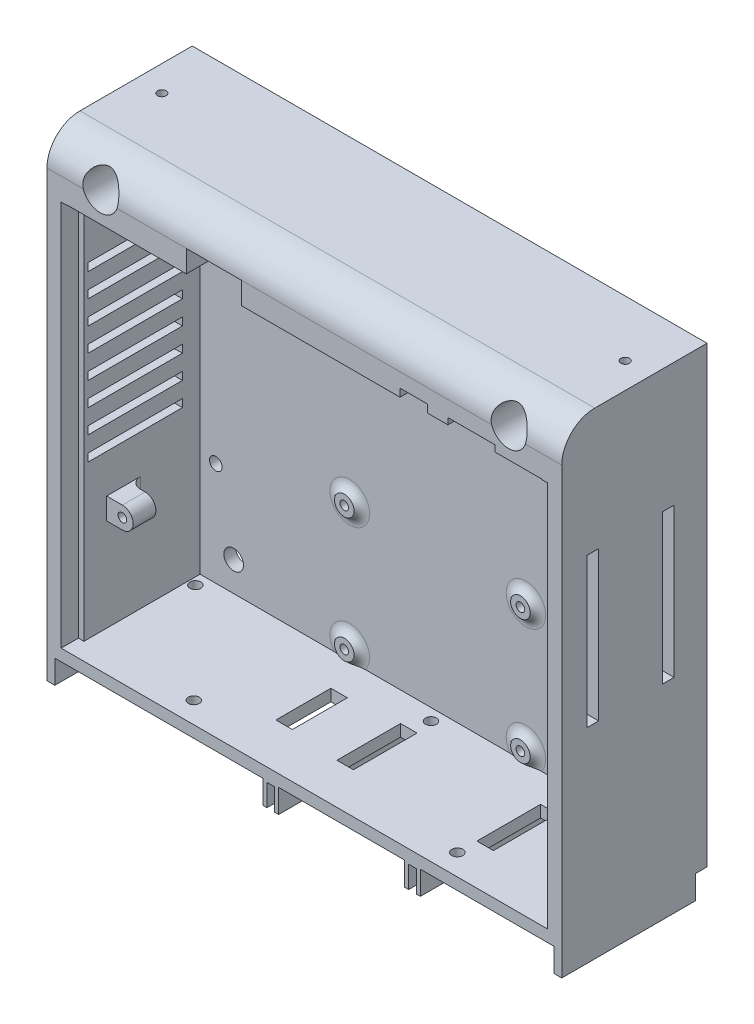
from build123d import *

# Parameters (mm, degrees)
CROQUIS1_W               = 131.1
CROQUIS1_H               = 109.5
SALIENTE_EXTRUIR2_DEPTH  = 39
CORTAR_EXTRUIR1_DEPTH    = 36
SALIENTE_EXTRUIR6_START  = 18
CROQUIS3_R               = 2.75
CROQUIS3_R_2             = 1.1
SALIENTE_EXTRUIR6_DEPTH  = 5.8
REDONDEO1_R              = 2.8
CROQUIS4_W               = 131.1
CROQUIS4_H               = 6
SALIENTE_EXTRUIR7_DEPTH  = 39
CORTAR_EXTRUIR3_REACH    = 181.021
CROQUIS5_W               = 24
CROQUIS5_H               = 2
CORTAR_EXTRUIR4_REACH    = 181.021
CROQUIS6_W               = 3
CROQUIS6_H               = 38
CORTAR_EXTRUIR5_START    = -10
CROQUIS7_R               = 1.6
CROQUIS7_R_2             = 1.1
CORTAR_EXTRUIR5_DEPTH    = 10
CROQUIS9_W               = 131.1
CROQUIS9_H               = 115.5
CORTAR_EXTRUIR6_DEPTH    = 2
CROQUIS10_W              = 1.4
CROQUIS10_H              = 98.387821421
CORTAR_EXTRUIR7_DEPTH    = 4.4
CORTAR_EXTRUIR9_REACH    = 180.596
CROQUIS13_R              = 2.5
CROQUIS12_R              = 4.5
CORTAR_EXTRUIR10_DEPTH   = 33
REDONDEO3_R              = 8.4
CORTAR_EXTRUIR11_REACH   = 180.596
CROQUIS15_R              = 1.1
CORTAR_EXTRUIR13_REACH   = 179.998
CROQUIS16_R              = 1.1
SALIENTE_EXTRUIR8_START  = 1.4
CROQUIS17_R              = 2.5
CROQUIS17_R_2            = 1.1
SALIENTE_EXTRUIR8_DEPTH  = 1.4
REDONDEO4_R              = 3
CORTAR_EXTRUIR14_REACH   = 180.596
CROQUIS18_W              = 4.2
CROQUIS18_H              = 16.2
CROQUIS18_H_2            = 14
CROQUIS19_W              = 2
CROQUIS19_H              = 6
SALIENTE_EXTRUIR10_DEPTH = 34
CORTAR_EXTRUIR15_REACH   = 180.596
CROQUIS22_R              = 1.4
CORTAR_EXTRUIR19_DEPTH   = 3


with BuildPart() as part:
    # Croquis1 → Saliente-Extruir2 (new body)
    with BuildSketch(Plane.XY):
        with Locations((65.55, 54.75)):
            Rectangle(CROQUIS1_W, CROQUIS1_H)
    extrude(amount=SALIENTE_EXTRUIR2_DEPTH)

    # Croquis2 → Cortar-Extruir1 (cut)
    with BuildSketch(Plane.XY.offset(39)):
        Polygon((5, 101.5), (35.5, 101.5), (35.5, 107.1), (49.5, 107.1), (49.5, 101.5), (89.9, 101.5), (89.9, 103.5), (96.9, 103.5), (96.9, 101.5), (102.1, 101.5), (102.1, 103.1), (114.1, 103.1), (114.1, 101.5), (126.1, 101.5), (126.1, 3), (5, 3), align=None)
    extrude(amount=-CORTAR_EXTRUIR1_DEPTH, mode=Mode.SUBTRACT)

    # Croquis3 → Saliente-Extruir6 (add)
    # profile 1 of 8: a face of its own
    with BuildSketch(Plane.XY.offset(3).offset(SALIENTE_EXTRUIR6_START)):
        with Locations((9, 97.5)):
            Circle(CROQUIS3_R)
        with Locations((9, 97.5)):
            Circle(CROQUIS3_R_2, mode=Mode.SUBTRACT)
    # profile 2 of 8: a face of its own
    with BuildSketch(Plane.XY.offset(3).offset(SALIENTE_EXTRUIR6_START)):
        with BuildLine():
            ThreePointArc((9, 94.75), (6.25, 97.5), (9, 100.25))
            Line((9, 100.25), (5, 100.25))
            Line((5, 100.25), (5, 94.75))
            Line((5, 94.75), (9, 94.75))
        make_face()
    # profile 3 of 8: a face of its own
    with BuildSketch(Plane.XY.offset(3).offset(SALIENTE_EXTRUIR6_START)):
        with Locations((122.1, 97.5)):
            Circle(CROQUIS3_R)
        with Locations((122.1, 97.5)):
            Circle(CROQUIS3_R_2, mode=Mode.SUBTRACT)
    # profile 4 of 8: a face of its own
    with BuildSketch(Plane.XY.offset(3).offset(SALIENTE_EXTRUIR6_START)):
        with BuildLine():
            Line((122.1, 94.75), (126.1, 94.75))
            Line((126.1, 94.75), (126.1, 100.25))
            Line((126.1, 100.25), (122.1, 100.25))
            ThreePointArc((122.1, 100.25), (124.044543648, 99.444543648), (124.85, 97.5))
            ThreePointArc((124.85, 97.5), (124.044543648, 95.555456352), (122.1, 94.75))
        make_face()
    # profile 5 of 8: a face of its own
    with BuildSketch(Plane.XY.offset(3).offset(SALIENTE_EXTRUIR6_START)):
        with Locations((122.1, 29.4)):
            Circle(CROQUIS3_R)
        with Locations((122.1, 29.4)):
            Circle(CROQUIS3_R_2, mode=Mode.SUBTRACT)
    # profile 6 of 8: a face of its own
    with BuildSketch(Plane.XY.offset(3).offset(SALIENTE_EXTRUIR6_START)):
        with BuildLine():
            ThreePointArc((124.85, 29.4), (124.044543648, 27.455456352), (122.1, 26.65))
            Line((122.1, 26.65), (126.1, 26.65))
            Line((126.1, 26.65), (126.1, 32.15))
            Line((126.1, 32.15), (122.1, 32.15))
            ThreePointArc((122.1, 32.15), (124.044543648, 31.344543648), (124.85, 29.4))
        make_face()
    # profile 7 of 8: a face of its own
    with BuildSketch(Plane.XY.offset(3).offset(SALIENTE_EXTRUIR6_START)):
        with Locations((9, 29.4)):
            Circle(CROQUIS3_R)
        with Locations((9, 29.4)):
            Circle(CROQUIS3_R_2, mode=Mode.SUBTRACT)
    # profile 8 of 8: a face of its own
    with BuildSketch(Plane.XY.offset(3).offset(SALIENTE_EXTRUIR6_START)):
        with BuildLine():
            Line((9, 32.15), (5, 32.15))
            Line((5, 32.15), (5, 26.65))
            Line((5, 26.65), (9, 26.65))
            ThreePointArc((9, 26.65), (6.25, 29.4), (9, 32.15))
        make_face()
    extrude(amount=SALIENTE_EXTRUIR6_DEPTH)

    # Redondeo1
    redondeo1_edges = [part.edges().sort_by_distance(p)[0] for p in [
        (5, 97.5, 21),
        (126.1, 97.5, 21),
        (126.1, 29.4, 21),
        (5, 29.4, 21),
    ]]
    fillet(redondeo1_edges, radius=REDONDEO1_R)

    # Croquis4 → Saliente-Extruir7 (add)
    with BuildSketch(Plane.XY.offset(39)):
        with Locations((65.55, 112.5)):
            Rectangle(CROQUIS4_W, CROQUIS4_H)
    extrude(amount=-SALIENTE_EXTRUIR7_DEPTH)

    # Croquis5 → Cortar-Extruir3 (cut, up to next)
    with BuildSketch(Plane.ZY, mode=Mode.PRIVATE) as cortar_extruir3_sk1:
        with Locations((19.5, 49)):
            Rectangle(CROQUIS5_W, CROQUIS5_H)
    cortar_extruir3_tool1 = extrude(cortar_extruir3_sk1.sketch, amount=-CORTAR_EXTRUIR3_REACH, mode=Mode.PRIVATE) & part.part
    # Croquis5 → Cortar-Extruir3 (cut, up to next)
    with BuildSketch(Plane.ZY, mode=Mode.PRIVATE) as cortar_extruir3_sk2:
        with Locations((19.5, 43)):
            Rectangle(CROQUIS5_W, CROQUIS5_H)
    cortar_extruir3_tool2 = extrude(cortar_extruir3_sk2.sketch, amount=-CORTAR_EXTRUIR3_REACH, mode=Mode.PRIVATE) & part.part
    # Croquis5 → Cortar-Extruir3 (cut, up to next)
    with BuildSketch(Plane.ZY, mode=Mode.PRIVATE) as cortar_extruir3_sk3:
        with Locations((19.5, 55)):
            Rectangle(CROQUIS5_W, CROQUIS5_H)
    cortar_extruir3_tool3 = extrude(cortar_extruir3_sk3.sketch, amount=-CORTAR_EXTRUIR3_REACH, mode=Mode.PRIVATE) & part.part
    # Croquis5 → Cortar-Extruir3 (cut, up to next)
    with BuildSketch(Plane.ZY, mode=Mode.PRIVATE) as cortar_extruir3_sk4:
        with Locations((19.5, 61)):
            Rectangle(CROQUIS5_W, CROQUIS5_H)
    cortar_extruir3_tool4 = extrude(cortar_extruir3_sk4.sketch, amount=-CORTAR_EXTRUIR3_REACH, mode=Mode.PRIVATE) & part.part
    # Croquis5 → Cortar-Extruir3 (cut, up to next)
    with BuildSketch(Plane.ZY, mode=Mode.PRIVATE) as cortar_extruir3_sk5:
        with Locations((19.5, 67)):
            Rectangle(CROQUIS5_W, CROQUIS5_H)
    cortar_extruir3_tool5 = extrude(cortar_extruir3_sk5.sketch, amount=-CORTAR_EXTRUIR3_REACH, mode=Mode.PRIVATE) & part.part
    # Croquis5 → Cortar-Extruir3 (cut, up to next)
    with BuildSketch(Plane.ZY, mode=Mode.PRIVATE) as cortar_extruir3_sk6:
        with Locations((19.5, 73)):
            Rectangle(CROQUIS5_W, CROQUIS5_H)
    cortar_extruir3_tool6 = extrude(cortar_extruir3_sk6.sketch, amount=-CORTAR_EXTRUIR3_REACH, mode=Mode.PRIVATE) & part.part
    # Croquis5 → Cortar-Extruir3 (cut, up to next)
    with BuildSketch(Plane.ZY, mode=Mode.PRIVATE) as cortar_extruir3_sk7:
        with Locations((19.5, 79)):
            Rectangle(CROQUIS5_W, CROQUIS5_H)
    cortar_extruir3_tool7 = extrude(cortar_extruir3_sk7.sketch, amount=-CORTAR_EXTRUIR3_REACH, mode=Mode.PRIVATE) & part.part
    # Croquis5 → Cortar-Extruir3 (cut, up to next)
    with BuildSketch(Plane.ZY, mode=Mode.PRIVATE) as cortar_extruir3_sk8:
        with Locations((19.5, 85)):
            Rectangle(CROQUIS5_W, CROQUIS5_H)
    cortar_extruir3_tool8 = extrude(cortar_extruir3_sk8.sketch, amount=-CORTAR_EXTRUIR3_REACH, mode=Mode.PRIVATE) & part.part
    add(cortar_extruir3_tool1.solids().sort_by_distance((0, 49, 19.5))[0], mode=Mode.SUBTRACT)
    add(cortar_extruir3_tool2.solids().sort_by_distance((0, 43, 19.5))[0], mode=Mode.SUBTRACT)
    add(cortar_extruir3_tool3.solids().sort_by_distance((0, 55, 19.5))[0], mode=Mode.SUBTRACT)
    add(cortar_extruir3_tool4.solids().sort_by_distance((0, 61, 19.5))[0], mode=Mode.SUBTRACT)
    add(cortar_extruir3_tool5.solids().sort_by_distance((0, 67, 19.5))[0], mode=Mode.SUBTRACT)
    add(cortar_extruir3_tool6.solids().sort_by_distance((0, 73, 19.5))[0], mode=Mode.SUBTRACT)
    add(cortar_extruir3_tool7.solids().sort_by_distance((0, 79, 19.5))[0], mode=Mode.SUBTRACT)
    add(cortar_extruir3_tool8.solids().sort_by_distance((0, 85, 19.5))[0], mode=Mode.SUBTRACT)

    # Croquis6 → Cortar-Extruir4 (cut, up to next)
    with BuildSketch(Plane(origin=(131.1, 0, 0), x_dir=(0, 0, -1), z_dir=(1, 0, 0)), mode=Mode.PRIVATE) as cortar_extruir4_sk1:
        with Locations((-29.1, 65)):
            Rectangle(CROQUIS6_W, CROQUIS6_H)
    cortar_extruir4_tool1 = extrude(cortar_extruir4_sk1.sketch, amount=-CORTAR_EXTRUIR4_REACH, mode=Mode.PRIVATE) & part.part
    # Croquis6 → Cortar-Extruir4 (cut, up to next)
    with BuildSketch(Plane(origin=(131.1, 0, 0), x_dir=(0, 0, -1), z_dir=(1, 0, 0)), mode=Mode.PRIVATE) as cortar_extruir4_sk2:
        with Locations((-9.9, 65)):
            Rectangle(CROQUIS6_W, CROQUIS6_H)
    cortar_extruir4_tool2 = extrude(cortar_extruir4_sk2.sketch, amount=-CORTAR_EXTRUIR4_REACH, mode=Mode.PRIVATE) & part.part
    add(cortar_extruir4_tool1.solids().sort_by_distance((131.1, 65, 29.1))[0], mode=Mode.SUBTRACT)
    add(cortar_extruir4_tool2.solids().sort_by_distance((131.1, 65, 9.9))[0], mode=Mode.SUBTRACT)

    # Croquis7 → Cortar-Extruir5 (cut)
    # profile 1 of 8: a face of its own
    with BuildSketch(Plane.XY.offset(3).offset(CORTAR_EXTRUIR5_START)):
        with Locations((9, 97.5)):
            Circle(CROQUIS7_R)
        with Locations((9, 97.5)):
            Circle(CROQUIS7_R_2, mode=Mode.SUBTRACT)
    # profile 2 of 8: a face of its own
    with BuildSketch(Plane.XY.offset(3).offset(CORTAR_EXTRUIR5_START)):
        with Locations((9, 97.5)):
            Circle(CROQUIS7_R_2)
    # profile 3 of 8: a face of its own
    with BuildSketch(Plane.XY.offset(3).offset(CORTAR_EXTRUIR5_START)):
        with Locations((122.1, 97.5)):
            Circle(CROQUIS7_R)
        with Locations((122.1, 97.5)):
            Circle(CROQUIS7_R_2, mode=Mode.SUBTRACT)
    # profile 4 of 8: a face of its own
    with BuildSketch(Plane.XY.offset(3).offset(CORTAR_EXTRUIR5_START)):
        with Locations((122.1, 97.5)):
            Circle(CROQUIS7_R_2)
    # profile 5 of 8: a face of its own
    with BuildSketch(Plane.XY.offset(3).offset(CORTAR_EXTRUIR5_START)):
        with Locations((122.1, 29.4)):
            Circle(CROQUIS7_R)
        with Locations((122.1, 29.4)):
            Circle(CROQUIS7_R_2, mode=Mode.SUBTRACT)
    # profile 6 of 8: a face of its own
    with BuildSketch(Plane.XY.offset(3).offset(CORTAR_EXTRUIR5_START)):
        with Locations((122.1, 29.4)):
            Circle(CROQUIS7_R_2)
    # profile 7 of 8: a face of its own
    with BuildSketch(Plane.XY.offset(3).offset(CORTAR_EXTRUIR5_START)):
        with Locations((9, 29.4)):
            Circle(CROQUIS7_R)
        with Locations((9, 29.4)):
            Circle(CROQUIS7_R_2, mode=Mode.SUBTRACT)
    # profile 8 of 8: a face of its own
    with BuildSketch(Plane.XY.offset(3).offset(CORTAR_EXTRUIR5_START)):
        with Locations((9, 29.4)):
            Circle(CROQUIS7_R_2)
    extrude(amount=CORTAR_EXTRUIR5_DEPTH, mode=Mode.SUBTRACT)

    # Croquis9 → Cortar-Extruir6 (cut)
    with BuildSketch(Plane.XY.offset(39)):
        with Locations((65.55, 57.75)):
            Rectangle(CROQUIS9_W, CROQUIS9_H)
    extrude(amount=-CORTAR_EXTRUIR6_DEPTH, mode=Mode.SUBTRACT)

    # Croquis10 → Cortar-Extruir7 (cut)
    with BuildSketch(Plane.XY.offset(37)):
        with Locations((4.3, 52.193910711)):
            Rectangle(CROQUIS10_W, CROQUIS10_H)
        with Locations((126.8, 52.193910711)):
            Rectangle(CROQUIS10_W, CROQUIS10_H)
    extrude(amount=-CORTAR_EXTRUIR7_DEPTH, mode=Mode.SUBTRACT)

    # Croquis13 → Cortar-Extruir9 (cut, up to next)
    with BuildSketch(Plane.XY.offset(37), mode=Mode.PRIVATE) as cortar_extruir9_sk1:
        with Locations((13.55, 108.5)):
            Circle(CROQUIS13_R)
    cortar_extruir9_tool1 = extrude(cortar_extruir9_sk1.sketch, amount=-CORTAR_EXTRUIR9_REACH, mode=Mode.PRIVATE) & part.part
    # Croquis13 → Cortar-Extruir9 (cut, up to next)
    with BuildSketch(Plane.XY.offset(37), mode=Mode.PRIVATE) as cortar_extruir9_sk2:
        with Locations((117.55, 108.5)):
            Circle(CROQUIS13_R)
    cortar_extruir9_tool2 = extrude(cortar_extruir9_sk2.sketch, amount=-CORTAR_EXTRUIR9_REACH, mode=Mode.PRIVATE) & part.part
    # Croquis13 → Cortar-Extruir9 (cut, up to next)
    with BuildSketch(Plane.XY.offset(37), mode=Mode.PRIVATE) as cortar_extruir9_sk3:
        with Locations(Location((13.55, 10.5, 0), (0, 0, 180))):
            Circle(CROQUIS13_R)
    cortar_extruir9_tool3 = extrude(cortar_extruir9_sk3.sketch, amount=-CORTAR_EXTRUIR9_REACH, mode=Mode.PRIVATE) & part.part
    # Croquis13 → Cortar-Extruir9 (cut, up to next)
    with BuildSketch(Plane.XY.offset(37), mode=Mode.PRIVATE) as cortar_extruir9_sk4:
        with Locations(Location((117.55, 10.5, 0), (0, 0, 180))):
            Circle(CROQUIS13_R)
    cortar_extruir9_tool4 = extrude(cortar_extruir9_sk4.sketch, amount=-CORTAR_EXTRUIR9_REACH, mode=Mode.PRIVATE) & part.part
    add(cortar_extruir9_tool1.solids().sort_by_distance((13.55, 108.5, 37))[0], mode=Mode.SUBTRACT)
    add(cortar_extruir9_tool2.solids().sort_by_distance((117.55, 108.5, 37))[0], mode=Mode.SUBTRACT)
    add(cortar_extruir9_tool3.solids().sort_by_distance((13.55, 10.5, 37))[0], mode=Mode.SUBTRACT)
    add(cortar_extruir9_tool4.solids().sort_by_distance((117.55, 10.5, 37))[0], mode=Mode.SUBTRACT)

    # Croquis12 → Cortar-Extruir10 (cut)
    with BuildSketch(Plane.XY.offset(37)):
        with Locations((13.55, 108.5)):
            Circle(CROQUIS12_R)
        with Locations(Location((117.55, 108.5, 0), (0, 0, 180))):
            Circle(CROQUIS12_R)
        with Locations((13.55, 10.5)):
            Circle(CROQUIS12_R)
        with Locations((117.55, 10.5)):
            Circle(CROQUIS12_R)
    extrude(amount=-CORTAR_EXTRUIR10_DEPTH, mode=Mode.SUBTRACT)

    # Redondeo3
    # the kernel refuses this fillet: 8.4 mm, written as the material it takes off along each edge
    with BuildSketch(Plane(origin=(152.1, 115.5, 37), x_dir=(0, -1, 0), z_dir=(-1, 0, 0))) as redondeo3_piece_1:
        with BuildLine():
            CenterArc((REDONDEO3_R, -REDONDEO3_R), REDONDEO3_R, 90, 90)
            Line((0, -REDONDEO3_R), (0, 0))
            Line((0, 0), (REDONDEO3_R, 0))
        make_face()
    extrude(amount=173.1, mode=Mode.SUBTRACT)

    # Croquis15 → Cortar-Extruir11 (cut, up to next)
    with BuildSketch(Plane(origin=(0, 115.5, 0), x_dir=(1, 0, 0), z_dir=(0, 1, 0)), mode=Mode.PRIVATE) as cortar_extruir11_sk1:
        with Locations(Location((6.55, -14.3, 0), (0, 0, 180))):
            Circle(CROQUIS15_R)
    cortar_extruir11_tool1 = extrude(cortar_extruir11_sk1.sketch, amount=-CORTAR_EXTRUIR11_REACH, mode=Mode.PRIVATE) & part.part
    # Croquis15 → Cortar-Extruir11 (cut, up to next)
    with BuildSketch(Plane(origin=(0, 115.5, 0), x_dir=(1, 0, 0), z_dir=(0, 1, 0)), mode=Mode.PRIVATE) as cortar_extruir11_sk2:
        with Locations(Location((124.55, -14.3, 0), (0, 0, 90))):
            Circle(CROQUIS15_R)
    cortar_extruir11_tool2 = extrude(cortar_extruir11_sk2.sketch, amount=-CORTAR_EXTRUIR11_REACH, mode=Mode.PRIVATE) & part.part
    add(cortar_extruir11_tool1.solids().sort_by_distance((6.55, 115.5, 14.3))[0], mode=Mode.SUBTRACT)
    add(cortar_extruir11_tool2.solids().sort_by_distance((124.55, 115.5, 14.3))[0], mode=Mode.SUBTRACT)

    # Croquis16 → Cortar-Extruir13 (cut, up to next)
    with BuildSketch(Plane.XY.offset(3), mode=Mode.PRIVATE) as cortar_extruir13_sk1:
        with Locations((43.12, 37.93)):
            Circle(CROQUIS16_R)
    cortar_extruir13_tool1 = extrude(cortar_extruir13_sk1.sketch, amount=-CORTAR_EXTRUIR13_REACH, mode=Mode.PRIVATE) & part.part
    # Croquis16 → Cortar-Extruir13 (cut, up to next)
    with BuildSketch(Plane.XY.offset(3), mode=Mode.PRIVATE) as cortar_extruir13_sk2:
        with Locations((87.98, 37.93)):
            Circle(CROQUIS16_R)
    cortar_extruir13_tool2 = extrude(cortar_extruir13_sk2.sketch, amount=-CORTAR_EXTRUIR13_REACH, mode=Mode.PRIVATE) & part.part
    # Croquis16 → Cortar-Extruir13 (cut, up to next)
    with BuildSketch(Plane.XY.offset(3), mode=Mode.PRIVATE) as cortar_extruir13_sk3:
        with Locations((87.98, 6.17)):
            Circle(CROQUIS16_R)
    cortar_extruir13_tool3 = extrude(cortar_extruir13_sk3.sketch, amount=-CORTAR_EXTRUIR13_REACH, mode=Mode.PRIVATE) & part.part
    # Croquis16 → Cortar-Extruir13 (cut, up to next)
    with BuildSketch(Plane.XY.offset(3), mode=Mode.PRIVATE) as cortar_extruir13_sk4:
        with Locations((43.12, 6.17)):
            Circle(CROQUIS16_R)
    cortar_extruir13_tool4 = extrude(cortar_extruir13_sk4.sketch, amount=-CORTAR_EXTRUIR13_REACH, mode=Mode.PRIVATE) & part.part
    add(cortar_extruir13_tool1.solids().sort_by_distance((43.12, 37.93, 3))[0], mode=Mode.SUBTRACT)
    add(cortar_extruir13_tool2.solids().sort_by_distance((87.98, 37.93, 3))[0], mode=Mode.SUBTRACT)
    add(cortar_extruir13_tool3.solids().sort_by_distance((87.98, 6.17, 3))[0], mode=Mode.SUBTRACT)
    add(cortar_extruir13_tool4.solids().sort_by_distance((43.12, 6.17, 3))[0], mode=Mode.SUBTRACT)

    # Croquis17 → Saliente-Extruir8 (add)
    # profile 1 of 4: a face of its own
    with BuildSketch(Plane.XY.offset(3).offset(SALIENTE_EXTRUIR8_START)):
        with Locations(Location((43.12, 37.93, 0), (0, 0, 180))):
            Circle(CROQUIS17_R)
        with Locations((43.12, 37.93)):
            Circle(CROQUIS17_R_2, mode=Mode.SUBTRACT)
    # profile 2 of 4: a face of its own
    with BuildSketch(Plane.XY.offset(3).offset(SALIENTE_EXTRUIR8_START)):
        with Locations(Location((87.98, 37.93, 0), (0, 0, 180))):
            Circle(CROQUIS17_R)
        with Locations((87.98, 37.93)):
            Circle(CROQUIS17_R_2, mode=Mode.SUBTRACT)
    # profile 3 of 4: a face of its own
    with BuildSketch(Plane.XY.offset(3).offset(SALIENTE_EXTRUIR8_START)):
        with Locations(Location((87.98, 6.17, 0), (0, 0, 180))):
            Circle(CROQUIS17_R)
        with Locations((87.98, 6.17)):
            Circle(CROQUIS17_R_2, mode=Mode.SUBTRACT)
    # profile 4 of 4: a face of its own
    with BuildSketch(Plane.XY.offset(3).offset(SALIENTE_EXTRUIR8_START)):
        with Locations(Location((43.12, 6.17, 0), (0, 0, 180))):
            Circle(CROQUIS17_R)
        with Locations((43.12, 6.17)):
            Circle(CROQUIS17_R_2, mode=Mode.SUBTRACT)
    extrude(amount=-SALIENTE_EXTRUIR8_DEPTH)

    # Redondeo4
    # the kernel refuses this fillet: 3 mm, written as the material it adds along each edge
    with BuildSketch(Plane(origin=(43.12, 37.93, 3), x_dir=(-1, 0, 0), z_dir=(0, 1, 0))) as redondeo4_piece_1:
        with BuildLine():
            CenterArc((5.037715508, 3), REDONDEO4_R, 212.230952635, 57.769047365)
            Line((5.037715508, 0), (5.037715508, -0.06))
            Line((5.037715508, -0.06), (2.5, -0.06))
            Line((2.5, -0.06), (2.44, 0))
            ThreePointArc((2.44, 0), (2.44, 0.7), (2.44924569, 1.368))
            Line((2.44924569, 1.368), (2.5, 1.4))
        make_face()
    revolve(axis=Axis((43.12, 37.93, 3), (0, 0, 1)))
    with BuildSketch(Plane(origin=(87.98, 37.93, 3), x_dir=(-1, 0, 0), z_dir=(0, 1, 0))) as redondeo4_piece_2:
        with BuildLine():
            CenterArc((5.037715508, 3), REDONDEO4_R, 212.230952635, 57.769047365)
            Line((5.037715508, 0), (5.037715508, -0.06))
            Line((5.037715508, -0.06), (2.5, -0.06))
            Line((2.5, -0.06), (2.44, 0))
            ThreePointArc((2.44, 0), (2.44, 0.7), (2.44924569, 1.368))
            Line((2.44924569, 1.368), (2.5, 1.4))
        make_face()
    revolve(axis=Axis((87.98, 37.93, 3), (0, 0, 1)))
    with BuildSketch(Plane(origin=(87.98, 6.17, 3), x_dir=(-1, 0, 0), z_dir=(0, 1, 0))) as redondeo4_piece_3:
        with BuildLine():
            CenterArc((5.037715508, 3), REDONDEO4_R, 212.230952635, 57.769047365)
            Line((5.037715508, 0), (5.037715508, -0.06))
            Line((5.037715508, -0.06), (2.5, -0.06))
            Line((2.5, -0.06), (2.44, 0))
            ThreePointArc((2.44, 0), (2.44, 0.7), (2.44924569, 1.368))
            Line((2.44924569, 1.368), (2.5, 1.4))
        make_face()
    revolve(axis=Axis((87.98, 6.17, 3), (0, 0, 1)))
    with BuildSketch(Plane(origin=(43.12, 6.17, 3), x_dir=(-1, 0, 0), z_dir=(0, 1, 0))) as redondeo4_piece_4:
        with BuildLine():
            CenterArc((5.037715508, 3), REDONDEO4_R, 212.230952635, 57.769047365)
            Line((5.037715508, 0), (5.037715508, -0.06))
            Line((5.037715508, -0.06), (2.5, -0.06))
            Line((2.5, -0.06), (2.44, 0))
            ThreePointArc((2.44, 0), (2.44, 0.7), (2.44924569, 1.368))
            Line((2.44924569, 1.368), (2.5, 1.4))
        make_face()
    revolve(axis=Axis((43.12, 6.17, 3), (0, 0, 1)))

    # Croquis18 → Cortar-Extruir14 (cut, up to next)
    with BuildSketch(Plane.XZ, mode=Mode.PRIVATE) as cortar_extruir14_sk1:
        with Locations((65.55, 18.5)):
            Rectangle(CROQUIS18_W, CROQUIS18_H)
    cortar_extruir14_tool1 = extrude(cortar_extruir14_sk1.sketch, amount=-CORTAR_EXTRUIR14_REACH, mode=Mode.PRIVATE) & part.part
    # Croquis18 → Cortar-Extruir14 (cut, up to next)
    with BuildSketch(Plane.XZ, mode=Mode.PRIVATE) as cortar_extruir14_sk2:
        with Locations((48.9, 18.5)):
            Rectangle(CROQUIS18_W, CROQUIS18_H_2)
    cortar_extruir14_tool2 = extrude(cortar_extruir14_sk2.sketch, amount=-CORTAR_EXTRUIR14_REACH, mode=Mode.PRIVATE) & part.part
    # Croquis18 → Cortar-Extruir14 (cut, up to next)
    with BuildSketch(Plane.XZ, mode=Mode.PRIVATE) as cortar_extruir14_sk3:
        with Locations((101.2, 18.5)):
            Rectangle(CROQUIS18_W, CROQUIS18_H)
    cortar_extruir14_tool3 = extrude(cortar_extruir14_sk3.sketch, amount=-CORTAR_EXTRUIR14_REACH, mode=Mode.PRIVATE) & part.part
    add(cortar_extruir14_tool1.solids().sort_by_distance((65.55, 0, 18.5))[0], mode=Mode.SUBTRACT)
    add(cortar_extruir14_tool2.solids().sort_by_distance((48.9, 0, 18.5))[0], mode=Mode.SUBTRACT)
    add(cortar_extruir14_tool3.solids().sort_by_distance((101.2, 0, 18.5))[0], mode=Mode.SUBTRACT)

    # Croquis19 → Saliente-Extruir10 (add)
    with BuildSketch(Plane.XY.offset(37)):
        with Locations((1, -3)):
            Rectangle(CROQUIS19_W, CROQUIS19_H)
        with Locations((56, -3)):
            Rectangle(CROQUIS19_W, CROQUIS19_H)
        with Locations((58, -3)):
            Rectangle(CROQUIS19_W, CROQUIS19_H)
        with Locations((130.1, -3)):
            Rectangle(CROQUIS19_W, CROQUIS19_H)
        with Locations((94.1, -3)):
            Rectangle(CROQUIS19_W, CROQUIS19_H)
        with Locations((92.1, -3)):
            Rectangle(CROQUIS19_W, CROQUIS19_H)
    extrude(amount=-SALIENTE_EXTRUIR10_DEPTH)

    # Croquis20 → Cortar-Extruir15 (cut, up to next)
    with BuildSketch(Plane.XY.offset(37), mode=Mode.PRIVATE) as cortar_extruir15_sk1:
        Polygon((57, -6), (58, -6), (58, -0.4), (56, -0.4), (56, -6), align=None)
    cortar_extruir15_tool1 = extrude(cortar_extruir15_sk1.sketch, amount=-CORTAR_EXTRUIR15_REACH, mode=Mode.PRIVATE) & part.part
    # Croquis20 → Cortar-Extruir15 (cut, up to next)
    with BuildSketch(Plane.XY.offset(37), mode=Mode.PRIVATE) as cortar_extruir15_sk2:
        Polygon((93.1, -6), (94.1, -6), (94.1, -0.4), (92.1, -0.4), (92.1, -6), align=None)
    cortar_extruir15_tool2 = extrude(cortar_extruir15_sk2.sketch, amount=-CORTAR_EXTRUIR15_REACH, mode=Mode.PRIVATE) & part.part
    add(cortar_extruir15_tool1.solids().sort_by_distance((57, -3.2, 37))[0], mode=Mode.SUBTRACT)
    add(cortar_extruir15_tool2.solids().sort_by_distance((93.1, -3.2, 37))[0], mode=Mode.SUBTRACT)

    # Croquis22 → Cortar-Extruir19 (cut)
    with BuildSketch(Plane.XZ):
        with Locations(Location((6.8, 6, 0), (0, 0, 270))):
            Circle(CROQUIS22_R)
        with Locations(Location((66.8, 6, 0), (0, 0, 270))):
            Circle(CROQUIS22_R)
        with Locations(Location((124.3, 6, 0), (0, 0, 270))):
            Circle(CROQUIS22_R)
        with Locations(Location((32, 31.6, 0), (0, 0, 270))):
            Circle(CROQUIS22_R)
        with Locations(Location((99.1, 31.6, 0), (0, 0, 270))):
            Circle(CROQUIS22_R)
    extrude(amount=-CORTAR_EXTRUIR19_DEPTH, mode=Mode.SUBTRACT)


solid = part.part
